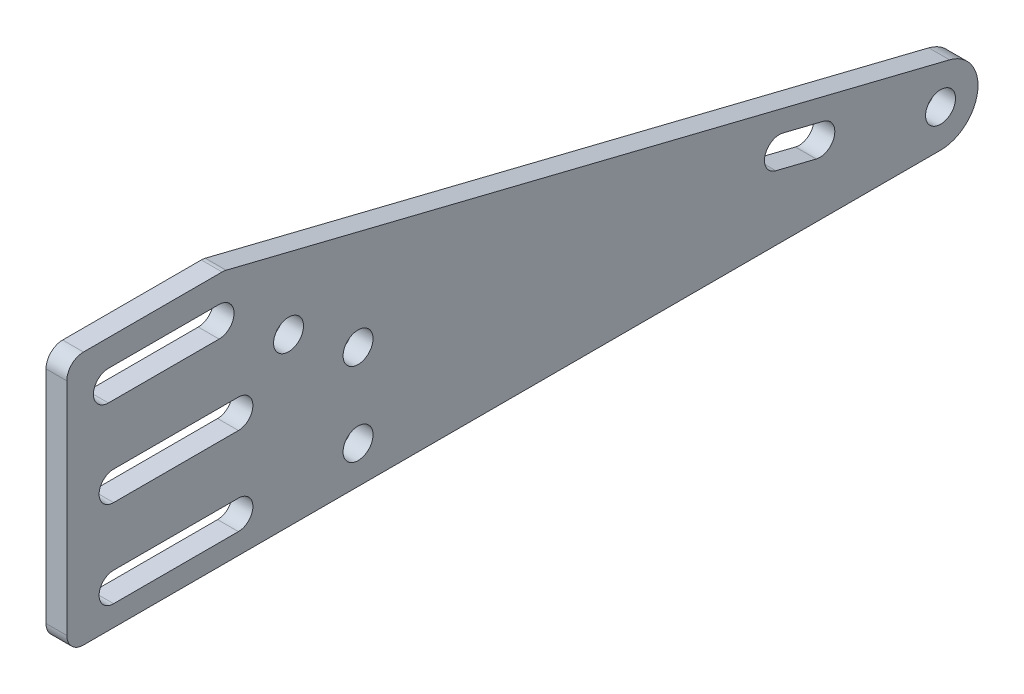
from build123d import *

# Parameters (mm, degrees)
SKETCH1_R           = 2.286
BOSS_EXTRUDE1_DEPTH = 3.175
SKETCH2_R           = 2.20991013
CUT_EXTRUDE1_DEPTH  = 99.353280322
CUT_EXTRUDE4_DEPTH  = 99.353280322


with BuildPart() as part:
    # Sketch1 → Boss-Extrude1 (new body)
    with BuildSketch(Plane(origin=(0, 0, 0), x_dir=(0, 0, -1), z_dir=(1, 0, 0))):
        with BuildLine():
            Line((-20.135783276, 26.595233027), (90.276415546, -0.80322569))
            ThreePointArc((90.276415546, -0.80322569), (94.572787682, -7.043328861), (88.9, -12.065))
            Line((88.9, -12.065), (0, -12.065))
            Line((0, -12.065), (-41.91, -12.065))
            ThreePointArc((-41.91, -12.065), (-43.706051224, -11.321051224), (-44.45, -9.525))
            Line((-44.45, -9.525), (-44.45, 24.13))
            ThreePointArc((-44.45, 24.13), (-43.706051224, 25.926051224), (-41.91, 26.67))
            Line((-41.91, 26.67), (-20.747523518, 26.67))
            ThreePointArc((-20.747523518, 26.67), (-20.439377358, 26.65123897), (-20.135783276, 26.595233027))
        make_face()
        with Locations((0, 6.35)):
            Circle(SKETCH1_R, mode=Mode.SUBTRACT)
        with Locations((0, -6.35)):
            Circle(SKETCH1_R, mode=Mode.SUBTRACT)
        with Locations((88.9, -6.35)):
            Circle(SKETCH1_R, mode=Mode.SUBTRACT)
        with Locations((-21.213182222, 20.32)):
            Circle(SKETCH1_R, mode=Mode.SUBTRACT)
        with Locations((-10.606591111, 13.335)):
            Circle(SKETCH1_R, mode=Mode.SUBTRACT)
        with Locations((-38.1, 20.32)):
            Circle(SKETCH1_R, mode=Mode.SUBTRACT)
    extrude(amount=BOSS_EXTRUDE1_DEPTH)

    # Sketch2 → Cut-Extrude1 (cut, through all)
    with BuildSketch(Plane(origin=(3.175, 0, 0), x_dir=(0, 0, -1), z_dir=(1, 0, 0))):
        with Locations((-37.310316922, 6.68008987)):
            Circle(SKETCH2_R)
        with Locations((-37.310316922, -6.68008987)):
            Circle(SKETCH2_R)
        with BuildLine():
            Line((64.861053538, 2.232227609), (71.024136105, 0.702877002))
            ThreePointArc((71.024136105, 0.702877002), (72.69227961, -2.06639894), (69.923003668, -3.734542446))
            Line((69.923003668, -3.734542446), (63.759921102, -2.205191839))
            ThreePointArc((63.759921102, -2.205191839), (62.091777596, 0.564084103), (64.861053538, 2.232227609))
        make_face()
    extrude(amount=-CUT_EXTRUDE1_DEPTH, mode=Mode.SUBTRACT)

    # Sketch5 → Cut-Extrude4 (cut, through all)
    with BuildSketch(Plane(origin=(3.175, 0, 0), x_dir=(0, 0, -1), z_dir=(1, 0, 0))):
        with BuildLine():
            Line((-21.213182222, 18.034), (-38.1, 18.034))
            ThreePointArc((-38.1, 18.034), (-40.386, 20.32), (-38.1, 22.606))
            Line((-38.1, 22.606), (-21.213182222, 22.606))
            ThreePointArc((-21.213182222, 22.606), (-18.927182222, 20.32), (-21.213182222, 18.034))
        make_face()
        with BuildLine():
            Line((-18.260316922, 4.47017974), (-37.310316922, 4.47017974))
            ThreePointArc((-37.310316922, 4.47017974), (-39.520227052, 6.68008987), (-37.310316922, 8.89))
            Line((-37.310316922, 8.89), (-18.260316922, 8.89))
            ThreePointArc((-18.260316922, 8.89), (-16.050406792, 6.68008987), (-18.260316922, 4.47017974))
        make_face()
        with BuildLine():
            Line((-18.260316922, -8.89), (-37.310316922, -8.89))
            ThreePointArc((-37.310316922, -8.89), (-39.520227052, -6.68008987), (-37.310316922, -4.47017974))
            Line((-37.310316922, -4.47017974), (-18.260316922, -4.47017974))
            ThreePointArc((-18.260316922, -4.47017974), (-16.050406792, -6.68008987), (-18.260316922, -8.89))
        make_face()
    extrude(amount=-CUT_EXTRUDE4_DEPTH, mode=Mode.SUBTRACT)


solid = part.part
